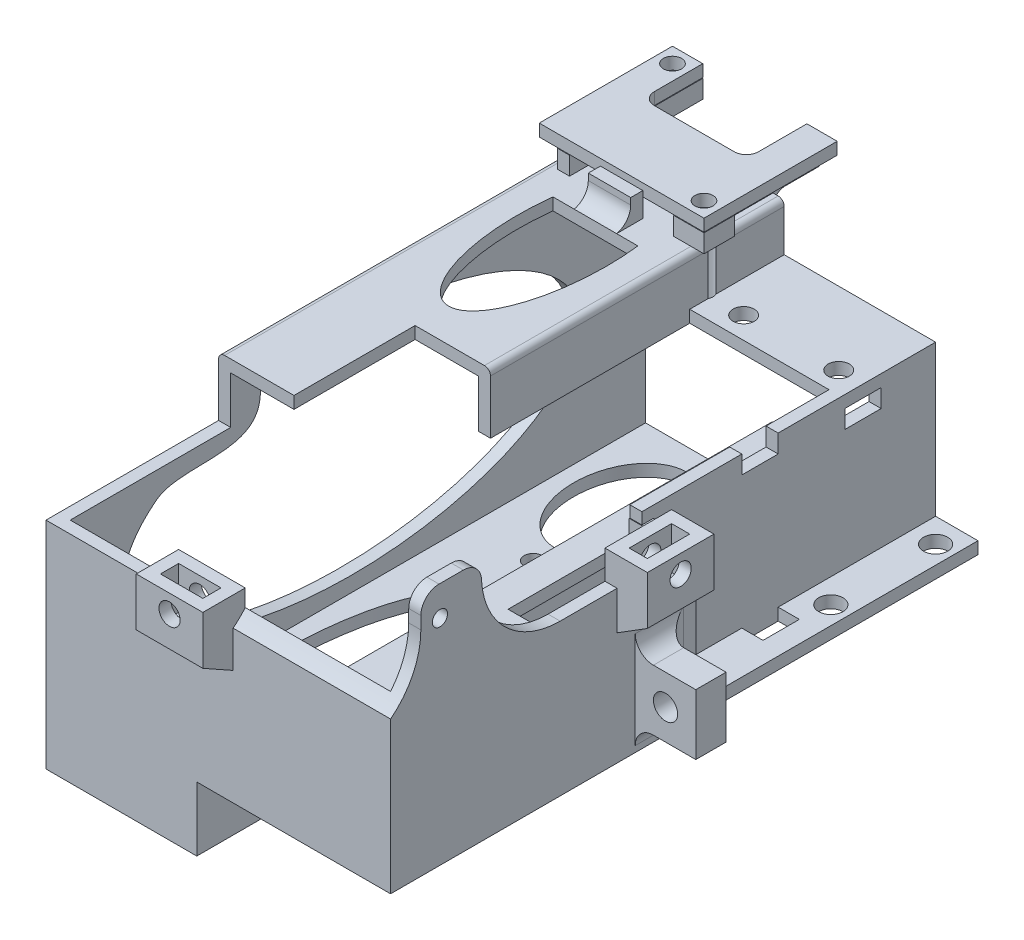
from build123d import *

# Parameters (mm, degrees)
SKETCH1_W             = 52.9
SKETCH1_H             = 95
BOSS_EXTRUDE1_DEPTH   = 2
BOSS_EXTRUDE2_START   = -2
BOSS_EXTRUDE2_DEPTH   = 25
SKETCH4_W             = 2
SKETCH4_H             = 48.5
BOSS_EXTRUDE3_DEPTH   = 9.8
SKETCH6_W             = 48.5
SKETCH6_H             = 2
BOSS_EXTRUDE4_DEPTH   = 22.9
SKETCH7_W             = 2
SKETCH7_H             = 48.5
BOSS_EXTRUDE5_DEPTH   = 7.9
SKETCH8_W             = 48.5
SKETCH8_H             = 2
BOSS_EXTRUDE6_DEPTH   = 25
BOSS_EXTRUDE7_DEPTH   = 20
SKETCH3_W             = 20
SKETCH3_H             = 33
CUT_EXTRUDE1_DEPTH    = 27.5
SKETCH62_W            = 32.9
SKETCH62_H            = 2
CUT_EXTRUDE25_DEPTH   = 3
BOSS_EXTRUDE10_START  = -3.25
SKETCH13_W            = 2
SKETCH13_H            = 11
BOSS_EXTRUDE10_DEPTH  = 8
SKETCH14_W            = 11
SKETCH14_H            = 8
BOSS_EXTRUDE11_DEPTH  = 5
SKETCH15_W            = 3
SKETCH15_H            = 7
CUT_EXTRUDE2_DEPTH    = 6
SKETCH16_R            = 1.75
CUT_EXTRUDE3_DEPTH    = 7.5
RIB8_REACH            = 78.695
SKETCH30_WALL_W       = 163.409370184
SKETCH30_WALL_H       = 11
SKETCH37_W            = 3
SKETCH37_H            = 7
CUT_EXTRUDE9_DEPTH    = 1
BOSS_EXTRUDE9_START   = -3.25
SKETCH12_W            = 11
SKETCH12_H            = 2
BOSS_EXTRUDE9_DEPTH   = 8
SKETCH18_W            = 11
SKETCH18_H            = 8
BOSS_EXTRUDE12_DEPTH  = 5
SKETCH20_W            = 7
SKETCH20_H            = 3
CUT_EXTRUDE4_DEPTH    = 6
SKETCH21_R            = 1.75
CUT_EXTRUDE5_DEPTH    = 10
RIB7_REACH            = 79.106
SKETCH29_WALL_W       = 163.36453659
SKETCH29_WALL_H       = 11
SKETCH38_W            = 7
SKETCH38_H            = 3
CUT_EXTRUDE10_DEPTH   = 1
SKETCH11_W            = 2
SKETCH11_H            = 10
BOSS_EXTRUDE8_DEPTH   = 15.3
CUT_EXTRUDE11_REACH   = 90.498
SKETCH41_R            = 1.25
FILLET1_R             = 13
FILLET2_R             = 13
FILLET4_R             = 3
FILLET5_R             = 1
CUT_EXTRUDE12_REACH   = 71.374
SKETCH42_R            = 1.75
SKETCH43_W            = 46.6
SKETCH43_H            = 2
BOSS_EXTRUDE15_DEPTH  = 3
SKETCH48_R            = 8
CUT_EXTRUDE17_DEPTH   = 1
CUT_EXTRUDE13_REACH   = 76.539
SKETCH44_R            = 2
SKETCH49_W            = 5
SKETCH49_H            = 10
BOSS_EXTRUDE16_DEPTH  = 10
CUT_EXTRUDE18_REACH   = 77.928
SKETCH50_R            = 2
FILLET6_R             = 3
CROQUIS18_W           = 1
CROQUIS18_H           = 46.6
CORTAR_EXTRUIR7_DEPTH = 77.912564043
SKETCH63_W            = 20.9
SKETCH63_H            = 95
CUT_EXTRUDE26_DEPTH   = 77.912564043
BOSS_EXTRUDE20_DEPTH  = 10.6
SKETCH65_W            = 20.9
SKETCH65_H            = 2
BOSS_EXTRUDE21_DEPTH  = 95
CUT_EXTRUDE29_DEPTH   = 10.6
CUT_EXTRUDE30_REACH   = 85.902
SKETCH67_RX           = 23.741671459
SKETCH67_RY           = 7.828156139
SKETCH67_RX_2         = 10.864940959
CUT_EXTRUDE21_REACH   = 78.913
SKETCH53_W            = 3.5
SKETCH53_H            = 6
CUT_EXTRUDE31_REACH   = 86.169
SKETCH69_W            = 6
SKETCH69_H            = 6
CUT_EXTRUDE32_REACH   = 86.169
SKETCH70_W            = 6
SKETCH70_H            = 4
CUT_EXTRUDE33_REACH   = 84.998
SKETCH71_W            = 6
SKETCH71_H            = 3
CUT_EXTRUDE34_REACH   = 85.902
SKETCH73_R            = 1.5
CUT_EXTRUDE35_REACH   = 82.683
SKETCH74_RX           = 18.708578128
SKETCH74_RY           = 7.33582549
SKETCH76_W            = 22.9
SKETCH76_H            = 18.723426022
BOSS_EXTRUDE22_DEPTH  = 2
SKETCH75_W            = 2
SKETCH75_H            = 22
BOSS_EXTRUDE23_DEPTH  = 3
SKETCH77_W            = 7
SKETCH77_H            = 2
BOSS_EXTRUDE24_DEPTH  = 4
FILLET7_START         = -19.5
FILLET7_DEPTH         = 7
FILLET8_R             = 2
SKETCH78_W            = 5
SKETCH78_H            = 3
BOSS_EXTRUDE25_DEPTH  = 3
SKETCH80_W            = 5
SKETCH80_H            = 3
BOSS_EXTRUDE27_DEPTH  = 3
CUT_EXTRUDE36_REACH   = 84.807
SKETCH81_R            = 1.5
SKETCH83_R            = 1.5
BOSS_EXTRUDE28_DEPTH  = 2
FILLET9_R             = 2


with BuildPart() as part:
    # Sketch1 → Boss-Extrude1 (new body)
    with BuildSketch(Plane(origin=(0, 0, 0), x_dir=(1, 0, 0), z_dir=(0, 1, 0))):
        Rectangle(SKETCH1_W, SKETCH1_H)
    extrude(amount=BOSS_EXTRUDE1_DEPTH)

    # Sketch2 → Boss-Extrude2 (add)
    with BuildSketch(Plane(origin=(0, 2, 0), x_dir=(1, 0, 0), z_dir=(0, 1, 0)).offset(BOSS_EXTRUDE2_START)):
        Polygon((-26.45, -47.5), (26.45, -47.5), (26.45, -1.1), (19.45, -1.1), (19.45, 47.5), (21.45, 47.5), (21.45, 0.9), (28.45, 0.9), (28.45, -49.5), (-28.45, -49.5), (-28.45, 47.5), (-26.45, 47.5), align=None)
    extrude(amount=BOSS_EXTRUDE2_DEPTH)

    # Sketch4 → Boss-Extrude3 (add)
    with BuildSketch(Plane(origin=(0, 25, 0), x_dir=(1, 0, 0), z_dir=(0, 1, 0))):
        with Locations((-27.45, 23.25)):
            Rectangle(SKETCH4_W, SKETCH4_H)
    extrude(amount=BOSS_EXTRUDE3_DEPTH)

    # Sketch6 → Boss-Extrude4 (add)
    with BuildSketch(Plane(origin=(-26.45, 0, 0), x_dir=(0, 0, -1), z_dir=(1, 0, 0))):
        with Locations((23.25, 33.8)):
            Rectangle(SKETCH6_W, SKETCH6_H)
    extrude(amount=BOSS_EXTRUDE4_DEPTH)

    # Sketch7 → Boss-Extrude5 (add)
    with BuildSketch(Plane.XZ.offset(-32.8)):
        with Locations((-4.55, -23.25)):
            Rectangle(SKETCH7_W, SKETCH7_H)
    extrude(amount=BOSS_EXTRUDE5_DEPTH)

    # Sketch8 → Boss-Extrude6 (add)
    with BuildSketch(Plane(origin=(-3.55, 0, 0), x_dir=(0, 0, -1), z_dir=(1, 0, 0))):
        with Locations((23.25, 25.9)):
            Rectangle(SKETCH8_W, SKETCH8_H)
    extrude(amount=BOSS_EXTRUDE6_DEPTH)

    # Sketch9 → Boss-Extrude7 (add)
    with BuildSketch(Plane.XY.offset(1)):
        Polygon((-28.45, 25), (-26.45, 25), (-26.45, 32.8), (-16, 32.8), (-16, 34.8), (-28.45, 34.8), align=None)
    extrude(amount=BOSS_EXTRUDE7_DEPTH)

    # Sketch3 → Cut-Extrude1 (cut, symmetric)
    with BuildSketch(Plane(origin=(0, 2, 0), x_dir=(1, 0, 0), z_dir=(0, 1, 0))):
        with Locations((9.45, 15.4)):
            Rectangle(SKETCH3_W, SKETCH3_H)
    extrude(amount=CUT_EXTRUDE1_DEPTH, both=True, mode=Mode.SUBTRACT)

    # Sketch62 → Cut-Extrude25 (cut)
    with BuildSketch(Plane(origin=(-0.55, 0, 0), x_dir=(0, 0, -1), z_dir=(1, 0, 0))):
        with Locations((15.45, 25.9)):
            Rectangle(SKETCH62_W, SKETCH62_H)
    extrude(amount=-CUT_EXTRUDE25_DEPTH, mode=Mode.SUBTRACT)

    # Sketch13 → Boss-Extrude10 (add)
    with BuildSketch(Plane(origin=(0, 25, 0), x_dir=(1, 0, 0), z_dir=(0, 1, 0)).offset(BOSS_EXTRUDE10_START)):
        with Locations((27.45, -6.6)):
            Rectangle(SKETCH13_W, SKETCH13_H)
    extrude(amount=BOSS_EXTRUDE10_DEPTH)

    # Sketch14 → Boss-Extrude11 (add)
    with BuildSketch(Plane(origin=(28.45, 0, 0), x_dir=(0, 0, -1), z_dir=(1, 0, 0))):
        with Locations((-6.6, 25.75)):
            Rectangle(SKETCH14_W, SKETCH14_H)
    extrude(amount=BOSS_EXTRUDE11_DEPTH)

    # Sketch15 → Cut-Extrude2 (cut)
    with BuildSketch(Plane(origin=(0, 29.75, 0), x_dir=(1, 0, 0), z_dir=(0, 1, 0))):
        with Locations((29.95, -6.6)):
            Rectangle(SKETCH15_W, SKETCH15_H)
    extrude(amount=-CUT_EXTRUDE2_DEPTH, mode=Mode.SUBTRACT)

    # Sketch16 → Cut-Extrude3 (cut, symmetric)
    with BuildSketch(Plane(origin=(28.45, 0, 0), x_dir=(0, 0, -1), z_dir=(1, 0, 0))):
        with Locations((-6.6, 26.75)):
            Circle(SKETCH16_R)
    extrude(amount=CUT_EXTRUDE3_DEPTH, both=True, mode=Mode.SUBTRACT)

    # Sketch30 wall → Rib8 (add, up to next)
    with BuildSketch(Plane(origin=(30.048221611, 19.627136036, 12.1), x_dir=(-0.848362101504, -0.529416419024, 0), z_dir=(0.529416419024, -0.848362101504, 0)), mode=Mode.PRIVATE) as rib8_sk1:
        with Locations((0, 5.5)):
            Rectangle(SKETCH30_WALL_W, SKETCH30_WALL_H)
    rib8_tool1 = extrude(rib8_sk1.sketch, amount=-RIB8_REACH, mode=Mode.PRIVATE) - part.part
    add(rib8_tool1.solids().sort_by_distance((30.048221611, 19.627136036, 12.1))[0])

    # Sketch37 → Cut-Extrude9 (cut)
    with BuildSketch(Plane(origin=(0, 23.75, 0), x_dir=(1, 0, 0), z_dir=(0, 1, 0))):
        with Locations((29.95, -6.6)):
            Rectangle(SKETCH37_W, SKETCH37_H)
    extrude(amount=-CUT_EXTRUDE9_DEPTH, mode=Mode.SUBTRACT)

    # Sketch12 → Boss-Extrude9 (add)
    with BuildSketch(Plane(origin=(0, 25, 0), x_dir=(1, 0, 0), z_dir=(0, 1, 0)).offset(BOSS_EXTRUDE9_START)):
        with Locations((-3.05, -48.5)):
            Rectangle(SKETCH12_W, SKETCH12_H)
    extrude(amount=BOSS_EXTRUDE9_DEPTH)

    # Sketch18 → Boss-Extrude12 (add)
    with BuildSketch(Plane.XY.offset(49.5)):
        with Locations((-3.05, 25.75)):
            Rectangle(SKETCH18_W, SKETCH18_H)
    extrude(amount=BOSS_EXTRUDE12_DEPTH)

    # Sketch20 → Cut-Extrude4 (cut)
    with BuildSketch(Plane(origin=(0, 29.75, 0), x_dir=(1, 0, 0), z_dir=(0, 1, 0))):
        with Locations((-3.05, -51)):
            Rectangle(SKETCH20_W, SKETCH20_H)
    extrude(amount=-CUT_EXTRUDE4_DEPTH, mode=Mode.SUBTRACT)

    # Sketch21 → Cut-Extrude5 (cut, symmetric)
    with BuildSketch(Plane.XY.offset(49.5)):
        with Locations((-3.05, 26.75)):
            Circle(SKETCH21_R)
    extrude(amount=CUT_EXTRUDE5_DEPTH, both=True, mode=Mode.SUBTRACT)

    # Sketch29 wall → Rib7 (add, up to next)
    with BuildSketch(Plane(origin=(-8.55, 20.002052384, 51.379667928), x_dir=(0, -0.488722912233, -0.872439060943), z_dir=(0, -0.872439060943, 0.488722912233)), mode=Mode.PRIVATE) as rib7_sk1:
        with Locations((0, 5.5)):
            Rectangle(SKETCH29_WALL_W, SKETCH29_WALL_H)
    rib7_tool1 = extrude(rib7_sk1.sketch, amount=-RIB7_REACH, mode=Mode.PRIVATE) - part.part
    add(rib7_tool1.solids().sort_by_distance((-8.55, 20.002052384, 51.379667928))[0])

    # Sketch38 → Cut-Extrude10 (cut)
    with BuildSketch(Plane(origin=(0, 23.75, 0), x_dir=(1, 0, 0), z_dir=(0, 1, 0))):
        with Locations((-3.05, -51)):
            Rectangle(SKETCH38_W, SKETCH38_H)
    extrude(amount=-CUT_EXTRUDE10_DEPTH, mode=Mode.SUBTRACT)

    # Sketch11 → Boss-Extrude8 (add)
    with BuildSketch(Plane(origin=(0, 25, 0), x_dir=(1, 0, 0), z_dir=(0, 1, 0))):
        with Locations((27.45, -39.5)):
            Rectangle(SKETCH11_W, SKETCH11_H)
    extrude(amount=BOSS_EXTRUDE8_DEPTH)

    # Sketch41 → Cut-Extrude11 (cut, up to next)
    with BuildSketch(Plane(origin=(28.45, 0, 0), x_dir=(0, 0, -1), z_dir=(1, 0, 0)), mode=Mode.PRIVATE) as cut_extrude11_sk1:
        with Locations((-41.35, 35.35)):
            Circle(SKETCH41_R)
    cut_extrude11_tool1 = extrude(cut_extrude11_sk1.sketch, amount=-CUT_EXTRUDE11_REACH, mode=Mode.PRIVATE) & part.part
    add(cut_extrude11_tool1.solids().sort_by_distance((28.45, 35.35, 41.35))[0], mode=Mode.SUBTRACT)

    # Fillet1
    fillet1_edges = [part.edges().sort_by_distance(p)[0] for p in [
        (27.45, 25, 34.5),
    ]]
    fillet(fillet1_edges, radius=FILLET1_R)

    # Fillet2
    # the kernel refuses this fillet: 13 mm, written as the material it adds along each edge
    with BuildSketch(Plane(origin=(0.832623085, 25, 44.5), x_dir=(0, 1, 0), z_dir=(1, 0, 0))) as fillet2_piece_1_section:
        with BuildLine():
            CenterArc((10.246950766, 13), FILLET2_R, 217.979872445, 52.020127555)
            Line((0, 5), (-0.204939015, 4.84))
            ThreePointArc((-0.204939015, 4.84), (-0.26, 2.5), (-0.26, 0))
            Line((-0.26, 0), (0, -0.26))
            Line((0, -0.26), (10.246950766, -0.26))
            Line((10.246950766, -0.26), (10.246950766, 0))
        make_face()
    fillet2_piece_1 = extrude(amount=27.617376915, mode=Mode.PRIVATE)
    fillet2_piece_1 = split(fillet2_piece_1, bisect_by=Plane(origin=(26.45, 25, 44.5), z_dir=(-1, 0, 0)), keep=Keep.TOP, mode=Mode.PRIVATE)
    fillet2_piece_1 = split(fillet2_piece_1, bisect_by=Plane(origin=(0.832623085, 25, 47.5), z_dir=(0, 0, 1)), keep=Keep.TOP, mode=Mode.PRIVATE)
    add(fillet2_piece_1)
    with BuildSketch(Plane(origin=(26.45, 25, 44.5), x_dir=(0, 1, 0), z_dir=(1, 0, 0))) as fillet2_piece_2_section:
        with BuildLine():
            CenterArc((10.246950766, 13), FILLET2_R, 217.979872445, 52.020127555)
            Line((0, 5), (-0.204939015, 4.84))
            ThreePointArc((-0.204939015, 4.84), (-0.26, 2.5), (-0.26, 0))
            Line((-0.26, 0), (0, -0.26))
            Line((0, -0.26), (10.246950766, -0.26))
            Line((10.246950766, -0.26), (10.246950766, 0))
        make_face()
    fillet2_piece_2 = extrude(amount=2, mode=Mode.PRIVATE)
    fillet2_piece_2 = split(fillet2_piece_2, bisect_by=Plane(origin=(26.45, 25, 47.5), z_dir=(0, 0, -1)), keep=Keep.TOP, mode=Mode.PRIVATE)
    add(fillet2_piece_2)
    with BuildSketch(Plane(origin=(26.45, 25, 44.5), x_dir=(0, 1, 0), z_dir=(1, 0, 0))) as fillet2_piece_3_section:
        with BuildLine():
            CenterArc((10.246950766, 13), FILLET2_R, 217.979872445, 52.020127555)
            Line((0, 5), (-0.204939015, 4.84))
            ThreePointArc((-0.204939015, 4.84), (-0.26, 2.5), (-0.26, 0))
            Line((-0.26, 0), (0, -0.26))
            Line((0, -0.26), (10.246950766, -0.26))
            Line((10.246950766, -0.26), (10.246950766, 0))
        make_face()
    fillet2_piece_3 = extrude(amount=2, mode=Mode.PRIVATE)
    fillet2_piece_3 = split(fillet2_piece_3, bisect_by=Plane(origin=(26.45, 25, 47.5), z_dir=(0, 0, 1)), keep=Keep.TOP, mode=Mode.PRIVATE)
    add(fillet2_piece_3)

    # Fillet4
    fillet4_edges = [part.edges().sort_by_distance(p)[0] for p in [
        (27.45, 40.3, 44.5),
        (27.45, 40.3, 34.5),
    ]]
    fillet(fillet4_edges, radius=FILLET4_R)

    # Fillet5
    fillet5_edges = [part.edges().sort_by_distance(p)[0] for p in [
        (-28.45, 34.8, -13.25),
        (-3.55, 34.8, -23.25),
    ]]
    fillet(fillet5_edges, radius=FILLET5_R)

    # Sketch42 → Cut-Extrude12 (cut, up to next)
    with BuildSketch(Plane(origin=(0, 26.9, 0), x_dir=(1, 0, 0), z_dir=(0, 1, 0)), mode=Mode.PRIVATE) as cut_extrude12_sk1:
        with Locations(Location((17.45, 35.5, 0), (0, 0, 180))):
            Circle(SKETCH42_R)
    cut_extrude12_tool1 = extrude(cut_extrude12_sk1.sketch, amount=-CUT_EXTRUDE12_REACH, mode=Mode.PRIVATE) & part.part
    # Sketch42 → Cut-Extrude12 (cut, up to next)
    with BuildSketch(Plane(origin=(0, 26.9, 0), x_dir=(1, 0, 0), z_dir=(0, 1, 0)), mode=Mode.PRIVATE) as cut_extrude12_sk2:
        with Locations(Location((1.75, 35.5, 0), (0, 0, 180))):
            Circle(SKETCH42_R)
    cut_extrude12_tool2 = extrude(cut_extrude12_sk2.sketch, amount=-CUT_EXTRUDE12_REACH, mode=Mode.PRIVATE) & part.part
    add(cut_extrude12_tool1.solids().sort_by_distance((17.45, 26.9, -35.5))[0], mode=Mode.SUBTRACT)
    add(cut_extrude12_tool2.solids().sort_by_distance((1.75, 26.9, -35.5))[0], mode=Mode.SUBTRACT)

    # Sketch43 → Boss-Extrude15 (add)
    with BuildSketch(Plane(origin=(26.45, 0, 0), x_dir=(0, 0, -1), z_dir=(1, 0, 0))):
        with Locations((24.2, 1)):
            Rectangle(SKETCH43_W, SKETCH43_H)
    extrude(amount=BOSS_EXTRUDE15_DEPTH)

    # Sketch48 → Cut-Extrude17 (cut)
    with BuildSketch(Plane(origin=(0, 2, 0), x_dir=(1, 0, 0), z_dir=(0, 1, 0))):
        with Locations(Location((10.25, -32.5, 0), (0, 0, 270))):
            Circle(SKETCH48_R)
    extrude(amount=-CUT_EXTRUDE17_DEPTH, mode=Mode.SUBTRACT)

    # Sketch44 → Cut-Extrude13 (cut, up to next)
    with BuildSketch(Plane(origin=(0, 2, 0), x_dir=(1, 0, 0), z_dir=(0, 1, 0)), mode=Mode.PRIVATE) as cut_extrude13_sk1:
        with Locations(Location((25.45, 43.5, 0), (0, 0, 270))):
            Circle(SKETCH44_R)
    cut_extrude13_tool1 = extrude(cut_extrude13_sk1.sketch, amount=-CUT_EXTRUDE13_REACH, mode=Mode.PRIVATE) & part.part
    # Sketch44 → Cut-Extrude13 (cut, up to next)
    with BuildSketch(Plane(origin=(0, 2, 0), x_dir=(1, 0, 0), z_dir=(0, 1, 0)), mode=Mode.PRIVATE) as cut_extrude13_sk2:
        with Locations(Location((25.45, 26.2, 0), (0, 0, 270))):
            Circle(SKETCH44_R)
    cut_extrude13_tool2 = extrude(cut_extrude13_sk2.sketch, amount=-CUT_EXTRUDE13_REACH, mode=Mode.PRIVATE) & part.part
    add(cut_extrude13_tool1.solids().sort_by_distance((25.45, 2, -43.5))[0], mode=Mode.SUBTRACT)
    add(cut_extrude13_tool2.solids().sort_by_distance((25.45, 2, -26.2))[0], mode=Mode.SUBTRACT)

    # Sketch49 → Boss-Extrude16 (add)
    with BuildSketch(Plane(origin=(28.45, 0, 0), x_dir=(0, 0, -1), z_dir=(1, 0, 0))):
        with Locations((-6.6, 9)):
            Rectangle(SKETCH49_W, SKETCH49_H)
    extrude(amount=BOSS_EXTRUDE16_DEPTH)

    # Sketch50 → Cut-Extrude18 (cut, up to next)
    with BuildSketch(Plane(origin=(0, 0, 4.1), x_dir=(-1, 0, 0), z_dir=(0, 0, -1)), mode=Mode.PRIVATE) as cut_extrude18_sk1:
        with Locations(Location((-33.45, 9, 0), (0, 0, 90))):
            Circle(SKETCH50_R)
    cut_extrude18_tool1 = extrude(cut_extrude18_sk1.sketch, amount=-CUT_EXTRUDE18_REACH, mode=Mode.PRIVATE) & part.part
    add(cut_extrude18_tool1.solids().sort_by_distance((33.45, 9, 4.1))[0], mode=Mode.SUBTRACT)

    # Fillet6
    fillet6_edges = [part.edges().sort_by_distance(p)[0] for p in [
        (28.45, 9, 4.1),
        (28.45, 14, 6.6),
        (28.45, 4, 6.6),
    ]]
    fillet(fillet6_edges, radius=FILLET6_R)

    # Croquis18 → cortar-extruir7 (cut, through all)
    with BuildSketch(Plane(origin=(0, 2, 0), x_dir=(1, 0, 0), z_dir=(0, 1, 0))):
        with Locations((28.95, 24.2)):
            Rectangle(CROQUIS18_W, CROQUIS18_H)
    extrude(amount=-CORTAR_EXTRUIR7_DEPTH, mode=Mode.SUBTRACT)

    # Sketch63 → Cut-Extrude26 (cut, through all)
    with BuildSketch(Plane(origin=(0, 2, 0), x_dir=(1, 0, 0), z_dir=(0, 1, 0))):
        with Locations((-16, 0)):
            Rectangle(SKETCH63_W, SKETCH63_H)
    extrude(amount=-CUT_EXTRUDE26_DEPTH, mode=Mode.SUBTRACT)

    # Sketch64 → Boss-Extrude20 (add)
    with BuildSketch(Plane.XZ):
        Polygon((-26.45, -47.5), (-28.45, -47.5), (-28.45, 49.5), (-3.55, 49.5), (-3.55, -47.5), (-5.55, -47.5), (-5.55, 47.5), (-26.45, 47.5), align=None)
    extrude(amount=BOSS_EXTRUDE20_DEPTH)

    # Sketch65 → Boss-Extrude21 (add)
    with BuildSketch(Plane(origin=(0, 0, 47.5), x_dir=(-1, 0, 0), z_dir=(0, 0, -1))):
        with Locations((16, -9.6)):
            Rectangle(SKETCH65_W, SKETCH65_H)
    extrude(amount=BOSS_EXTRUDE21_DEPTH)

    # Sketch66 → Cut-Extrude29 (cut)
    with BuildSketch(Plane.ZY.offset(28.45)):
        with BuildLine():
            add(Edge.make_bspline(
                [(16.100140349, 27.824163291), (-31.58369167, 37.621613561), (-36.517871658, 13.27882778), (-41.452051646, -11.063958001), (9.31066282, -5.67173622), (60.073377286, -0.27951444), (33.33209531, 20.698575073)],
                knots=[1.158553074, 1.158553074, 1.158553074, 3.046641897, 3.046641897, 4.93473072, 4.93473072, 6.822819543, 6.822819543, 6.822819543], degree=2, weights=[1, 0.586517113, 1, 0.586517113, 1, 0.586517113, 1]))
            add(Edge.make_bspline(
                [(16.100140349, 27.824163291), (15.940267114, 18.918446359), (29.011396198, 24.06213165), (33.33209531, 20.698575073)],
                knots=[0, 0, 0, 0, 1, 1, 1, 1], degree=3))
        make_face()
    extrude(amount=-CUT_EXTRUDE29_DEPTH, mode=Mode.SUBTRACT)

    # Sketch67 → Cut-Extrude30 (cut, up to next)
    with BuildSketch(Plane.XZ.offset(10.6), mode=Mode.PRIVATE) as cut_extrude30_sk1:
        with Locations(Location((-16, 15.5), (0, 0, -90))):
            Ellipse(SKETCH67_RX, SKETCH67_RY)
    cut_extrude30_tool1 = extrude(cut_extrude30_sk1.sketch, amount=-CUT_EXTRUDE30_REACH, mode=Mode.PRIVATE) & part.part
    # Sketch67 → Cut-Extrude30 (cut, up to next)
    with BuildSketch(Plane.XZ.offset(10.6), mode=Mode.PRIVATE) as cut_extrude30_sk2:
        with Locations(Location((-16, -33), (0, 0, -90))):
            Ellipse(SKETCH67_RX_2, SKETCH67_RY)
    cut_extrude30_tool2 = extrude(cut_extrude30_sk2.sketch, amount=-CUT_EXTRUDE30_REACH, mode=Mode.PRIVATE) & part.part
    add(cut_extrude30_tool1.solids().sort_by_distance((-16, -10.6, 15.5))[0], mode=Mode.SUBTRACT)
    add(cut_extrude30_tool2.solids().sort_by_distance((-16, -10.6, -33))[0], mode=Mode.SUBTRACT)

    # Sketch53 → Cut-Extrude21 (cut, up to next)
    with BuildSketch(Plane(origin=(0, 2, 0), x_dir=(1, 0, 0), z_dir=(0, 1, 0)), mode=Mode.PRIVATE) as cut_extrude21_sk1:
        with Locations((23.2, 18.5)):
            Rectangle(SKETCH53_W, SKETCH53_H)
    cut_extrude21_tool1 = extrude(cut_extrude21_sk1.sketch, amount=-CUT_EXTRUDE21_REACH, mode=Mode.PRIVATE) & part.part
    add(cut_extrude21_tool1.solids().sort_by_distance((23.2, 2, -18.5))[0], mode=Mode.SUBTRACT)

    # Sketch69 → Cut-Extrude31 (cut, up to next)
    with BuildSketch(Plane(origin=(21.45, 0, 0), x_dir=(0, 0, -1), z_dir=(1, 0, 0)), mode=Mode.PRIVATE) as cut_extrude31_sk1:
        with Locations((18.5, 26.9)):
            Rectangle(SKETCH69_W, SKETCH69_H)
    cut_extrude31_tool1 = extrude(cut_extrude31_sk1.sketch, amount=-CUT_EXTRUDE31_REACH, mode=Mode.PRIVATE) & part.part
    add(cut_extrude31_tool1.solids().sort_by_distance((21.45, 26.9, -18.5))[0], mode=Mode.SUBTRACT)

    # Sketch70 → Cut-Extrude32 (cut, up to next)
    with BuildSketch(Plane(origin=(21.45, 0, 0), x_dir=(0, 0, -1), z_dir=(1, 0, 0)), mode=Mode.PRIVATE) as cut_extrude32_sk1:
        with Locations((3.9, 4)):
            Rectangle(SKETCH70_W, SKETCH70_H)
    cut_extrude32_tool1 = extrude(cut_extrude32_sk1.sketch, amount=-CUT_EXTRUDE32_REACH, mode=Mode.PRIVATE) & part.part
    add(cut_extrude32_tool1.solids().sort_by_distance((21.45, 4, -3.9))[0], mode=Mode.SUBTRACT)

    # Sketch71 → Cut-Extrude33 (cut, up to next)
    with BuildSketch(Plane.ZY.offset(-19.45), mode=Mode.PRIVATE) as cut_extrude33_sk1:
        with Locations((-35.5, 23.4)):
            Rectangle(SKETCH71_W, SKETCH71_H)
    cut_extrude33_tool1 = extrude(cut_extrude33_sk1.sketch, amount=-CUT_EXTRUDE33_REACH, mode=Mode.PRIVATE) & part.part
    add(cut_extrude33_tool1.solids().sort_by_distance((19.45, 23.4, -35.5))[0], mode=Mode.SUBTRACT)

    # Sketch73 → Cut-Extrude34 (cut, up to next)
    with BuildSketch(Plane.XZ.offset(10.6), mode=Mode.PRIVATE) as cut_extrude34_sk1:
        with Locations(Location((-16, -18.5, 0), (0, 0, 270))):
            Circle(SKETCH73_R)
    cut_extrude34_tool1 = extrude(cut_extrude34_sk1.sketch, amount=-CUT_EXTRUDE34_REACH, mode=Mode.PRIVATE) & part.part
    add(cut_extrude34_tool1.solids().sort_by_distance((-16, -10.6, -18.5))[0], mode=Mode.SUBTRACT)

    # Sketch74 → Cut-Extrude35 (cut, up to next)
    with BuildSketch(Plane(origin=(0, 34.8, 0), x_dir=(1, 0, 0), z_dir=(0, 1, 0)), mode=Mode.PRIVATE) as cut_extrude35_sk1:
        with Locations(Location((-16, 23.25), (0, 0, 90))):
            Ellipse(SKETCH74_RX, SKETCH74_RY)
    cut_extrude35_tool1 = extrude(cut_extrude35_sk1.sketch, amount=-CUT_EXTRUDE35_REACH, mode=Mode.PRIVATE) & part.part
    add(cut_extrude35_tool1.solids().sort_by_distance((-16, 34.8, -23.25))[0], mode=Mode.SUBTRACT)

    # Sketch76 → Boss-Extrude22 (add)
    with BuildSketch(Plane(origin=(0, 34.8, 0), x_dir=(1, 0, 0), z_dir=(0, 1, 0))):
        with Locations((-16, 38.138286989)):
            Rectangle(SKETCH76_W, SKETCH76_H)
    extrude(amount=-BOSS_EXTRUDE22_DEPTH)

    # Sketch75 → Boss-Extrude23 (add)
    with BuildSketch(Plane(origin=(0, 34.8, 0), x_dir=(1, 0, 0), z_dir=(0, 1, 0))):
        with Locations((-25.6, 44.1)):
            Rectangle(SKETCH75_W, SKETCH75_H)
        with Locations((-6.4, 44.1)):
            Rectangle(SKETCH75_W, SKETCH75_H)
    extrude(amount=BOSS_EXTRUDE23_DEPTH)

    # Sketch77 → Boss-Extrude24 (add)
    with BuildSketch(Plane(origin=(0, 34.8, 0), x_dir=(1, 0, 0), z_dir=(0, 1, 0))):
        with Locations((-16, 32.1)):
            Rectangle(SKETCH77_W, SKETCH77_H)
    extrude(amount=BOSS_EXTRUDE24_DEPTH)

    # Fillet7: read off the stored shape, not the designer's step
    # Fillet7 outline → Fillet7 (add)
    with BuildSketch(Plane.YZ.offset(FILLET7_START)):
        with BuildLine():
            Line((34.8, -31.1), (37.722712379, -31.1))
            ThreePointArc((37.722712379, -31.1), (35.855859671, -30.448374111), (34.8, -28.776573978))
            Line((34.8, -28.776573978), (34.8, -31.1))
        make_face()
    extrude(amount=FILLET7_DEPTH)

    # Fillet8
    fillet8_edges = [part.edges().sort_by_distance(p)[0] for p in [
        (-6.4, 34.8, -47.5),
        (-25.6, 34.8, -47.5),
    ]]
    fillet(fillet8_edges, radius=FILLET8_R - 0.0001)  # a hair under: the kernel refuses the full size

    # Sketch78 → Boss-Extrude25 (add)
    with BuildSketch(Plane.ZY.offset(26.6)):
        with Locations((-52.6, 36.3)):
            Rectangle(SKETCH78_W, SKETCH78_H)
    extrude(amount=BOSS_EXTRUDE25_DEPTH)

    # Sketch80 → Boss-Extrude27 (add)
    with BuildSketch(Plane(origin=(-5.4, 0, 0), x_dir=(0, 0, -1), z_dir=(1, 0, 0))):
        with Locations((35.6, 36.3)):
            Rectangle(SKETCH80_W, SKETCH80_H)
    extrude(amount=BOSS_EXTRUDE27_DEPTH)

    # Sketch81 → Cut-Extrude36 (cut, up to next)
    with BuildSketch(Plane(origin=(0, 37.8, 0), x_dir=(1, 0, 0), z_dir=(0, 1, 0)), mode=Mode.PRIVATE) as cut_extrude36_sk1:
        with Locations(Location((-27.1, 52.6, 0), (0, 0, 270))):
            Circle(SKETCH81_R)
    cut_extrude36_tool1 = extrude(cut_extrude36_sk1.sketch, amount=-CUT_EXTRUDE36_REACH, mode=Mode.PRIVATE) & part.part
    # Sketch81 → Cut-Extrude36 (cut, up to next)
    with BuildSketch(Plane(origin=(0, 37.8, 0), x_dir=(1, 0, 0), z_dir=(0, 1, 0)), mode=Mode.PRIVATE) as cut_extrude36_sk2:
        with Locations(Location((-4.9, 35.6, 0), (0, 0, 270))):
            Circle(SKETCH81_R)
    cut_extrude36_tool2 = extrude(cut_extrude36_sk2.sketch, amount=-CUT_EXTRUDE36_REACH, mode=Mode.PRIVATE) & part.part
    add(cut_extrude36_tool1.solids().sort_by_distance((-27.1, 37.8, -52.6))[0], mode=Mode.SUBTRACT)
    add(cut_extrude36_tool2.solids().sort_by_distance((-4.9, 37.8, -35.6))[0], mode=Mode.SUBTRACT)


with BuildPart() as body_2:
    # Sketch83 → Boss-Extrude28 (new body)
    with BuildSketch(Plane(origin=(0, 37.9, 0), x_dir=(1, 0, 0), z_dir=(0, 1, 0))):
        Polygon((-2.4, 55.1), (-7.4, 55.1), (-7.4, 45.1), (-24.6, 45.1), (-24.6, 55.1), (-29.6, 55.1), (-29.6, 33.1), (-2.4, 33.1), align=None)
        with Locations(Location((-27.1, 52.6, 0), (0, 0, 270))):
            Circle(SKETCH83_R, mode=Mode.SUBTRACT)
        with Locations(Location((-4.9, 35.6, 0), (0, 0, 270))):
            Circle(SKETCH83_R, mode=Mode.SUBTRACT)
    extrude(amount=BOSS_EXTRUDE28_DEPTH)

    # Fillet9
    fillet9_edges = [body_2.edges().sort_by_distance(p)[0] for p in [
        (-24.6, 38.9, -45.1),
        (-7.4, 38.9, -45.1),
    ]]
    fillet(fillet9_edges, radius=FILLET9_R)


solid = Compound([part.part, body_2.part])
